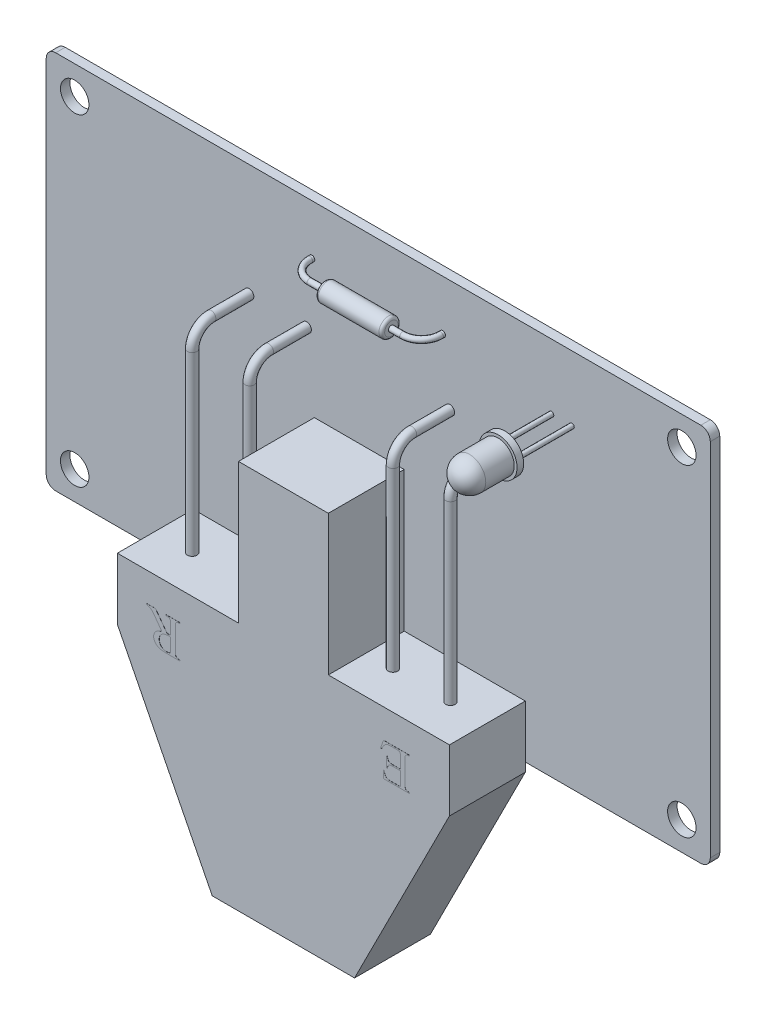
from build123d import *

# Parameters (mm, degrees)
ESQUISSE1_R             = 1.5
BOSS_EXTRU_1_DEPTH      = 1
BOSS_EXTRU_2_START      = 2
BOSS_EXTRU_2_DEPTH      = 8
ESQUISSE3_R             = 0.5
BOSS_EXTRU_3_DEPTH      = 3.5
BOSS_EXTRU_3_DEPTH_BACK = 3.5
BOSS_EXTRU_3_START      = 0.1
ESQUISSE4_R             = 1
ESQUISSE6_R             = 0.3
CONG_1_R                = 0.3
ESQUISSE7_R             = 0.3
CONG_2_R                = 0.3
BOSS_EXTRU_4_START      = 6
ESQUISSE8_R             = 2
BOSS_EXTRU_4_DEPTH      = 0.7
ESQUISSE9_R             = 1.7
BOSS_EXTRU_5_DEPTH      = 3
ESQUISSE10_R            = 0.25
BOSS_EXTRU_6_DEPTH      = 6
BOSS_EXTRU_7_DEPTH      = 0.01


# Read off the part's stored shape, not the designer's step: Dôme1
with BuildPart() as part:
    # Esquisse1 → Boss.-Extru.1 (new body)
    with BuildSketch(Plane.XY):
        with BuildLine():
            Line((-34, 20), (34, 20))
            ThreePointArc((34, 20), (34.707106781, 19.707106781), (35, 19))
            Line((35, 19), (35, -19))
            ThreePointArc((35, -19), (34.707106781, -19.707106781), (34, -20))
            Line((34, -20), (-34, -20))
            ThreePointArc((-34, -20), (-34.707106781, -19.707106781), (-35, -19))
            Line((-35, -19), (-35, 19))
            ThreePointArc((-35, 19), (-34.707106781, 19.707106781), (-34, 20))
        make_face()
        with Locations((-32, 17)):
            Circle(ESQUISSE1_R, mode=Mode.SUBTRACT)
        with Locations((-32, -17)):
            Circle(ESQUISSE1_R, mode=Mode.SUBTRACT)
        with Locations((32, -17)):
            Circle(ESQUISSE1_R, mode=Mode.SUBTRACT)
        with Locations((32, 17)):
            Circle(ESQUISSE1_R, mode=Mode.SUBTRACT)
    extrude(amount=BOSS_EXTRU_1_DEPTH)



with BuildPart() as body_2:
    # Esquisse2 → Boss.-Extru.2 (new body)
    with BuildSketch(Plane.XY.offset(1).offset(BOSS_EXTRU_2_START)):
        Polygon((-7.5, -38.715067479), (7.5, -38.715067479), (17.5, -18.929232373), (17.5, -12.431567499), (4.734720918, -12.431567499), (4.734720918, 2.327559899), (-4.734720918, 2.327559899), (-4.734720918, -12.431567499), (-17.5, -12.431567499), (-17.5, -18.929232373), align=None)
    extrude(amount=BOSS_EXTRU_2_DEPTH)


with BuildPart() as part_1:
    add(part.part)

    add(body_2.part)  # Balayage1 merges body 2
    # Balayage1: sweep along a curve in space
    with BuildLine() as balayage1_path:
        Line((-13.614984304, -12.431567499, 7), (-13.614984304, 6.168998197, 7))
        ThreePointArc((-13.614984304, 6.168998197, 7), (-13.614984304, 7.58321176, 6.414213562), (-13.614984304, 8.168998197, 5))
        Line((-13.614984304, 8.168998197, 5), (-13.614984304, 8.168998197, 0.395838291))
    # Esquisse3 → Balayage1 (sweep)
    with BuildSketch(Plane(origin=(0, -12.431567499, 0), x_dir=(1, 0, 0), z_dir=(0, 1, 0))):
        with Locations((-13.614984304, -7)):
            Circle(ESQUISSE3_R)
        with Locations((-7.547533543, -7)):
            Circle(ESQUISSE3_R)
    balayage1 = sweep(path=balayage1_path.line)

    # Symétrie1: Balayage1 across plane
    add(balayage1.mirror(Plane(origin=(0, 0, 0), x_dir=(0, 0, 1), z_dir=(1, 0, 0))))



with BuildPart() as body_2_2:
    # Esquisse4 → Boss.-Extru.3 (new, two sides: drawn at the far end of the back side and taken through both)
    with BuildSketch(Plane(origin=(0, 0, 0), x_dir=(0, 0, -1), z_dir=(1, 0, 0)).offset(BOSS_EXTRU_3_START - BOSS_EXTRU_3_DEPTH_BACK)):
        with Locations((-3.223593846, 14.735520351)):
            Circle(ESQUISSE4_R)
    extrude(amount=BOSS_EXTRU_3_DEPTH + BOSS_EXTRU_3_DEPTH_BACK)


with BuildPart() as part_2:
    add(part_1.part)

    add(body_2_2.part)  # Balayage2 merges body 2 2
    # Balayage2: sweep along a curve in space
    with BuildLine() as balayage2_path:
        Line((3.6, 14.735520351, 3.223593846), (4.788840172, 14.735520351, 3.223593846))
        ThreePointArc((4.788840172, 14.735520351, 3.223593846), (6.203053735, 14.735520351, 2.637807408), (6.788840172, 14.735520351, 1.223593846))
        Line((6.788840172, 14.735520351, 1.223593846), (6.788840172, 14.735520351, 0.585823354))
    # Esquisse6 → Balayage2 (sweep)
    with BuildSketch(Plane(origin=(3.6, 0, 0), x_dir=(0, 0, -1), z_dir=(1, 0, 0))):
        with Locations((-3.223593846, 14.735520351)):
            Circle(ESQUISSE6_R)
    sweep(path=balayage2_path.line)

    # Congé1
    cong_1_edges = [part_2.edges().sort_by_distance(p)[0] for p in [
        (3.6, 14.735520351, 4.223593846),
    ]]
    fillet(cong_1_edges, radius=CONG_1_R)

    # Balayage3: sweep along a curve in space
    with BuildLine() as balayage3_path:
        Line((-3.4, 14.735520351, 3.223593846), (-4.993022094, 14.735520351, 3.223593846))
        ThreePointArc((-4.993022094, 14.735520351, 3.223593846), (-6.407235656, 14.735520351, 2.637807408), (-6.993022094, 14.735520351, 1.223593846))
        Line((-6.993022094, 14.735520351, 1.223593846), (-6.993022094, 14.735520351, 0.556615196))
    # Esquisse7 → Balayage3 (sweep)
    with BuildSketch(Plane.ZY.offset(3.4)):
        with Locations((3.223593846, 14.735520351)):
            Circle(ESQUISSE7_R)
    sweep(path=balayage3_path.line)

    # Congé2
    cong_2_edges = [part_2.edges().sort_by_distance(p)[0] for p in [
        (-3.4, 14.735520351, 4.223593846),
    ]]
    fillet(cong_2_edges, radius=CONG_2_R)



with BuildPart() as body_2_3:
    # Esquisse8 → Boss.-Extru.4 (new body)
    with BuildSketch(Plane.XY.offset(1).offset(BOSS_EXTRU_4_START)):
        with Locations((19.333488089, 13.149891711)):
            Circle(ESQUISSE8_R)
    extrude(amount=BOSS_EXTRU_4_DEPTH)

    # Esquisse9 → Boss.-Extru.5 (add)
    with BuildSketch(Plane.XY.offset(7.7)):
        with Locations((19.333488089, 13.149891711)):
            Circle(ESQUISSE9_R)
    extrude(amount=BOSS_EXTRU_5_DEPTH)

    # Dôme1 outline → Dôme1 (revolve)
    with BuildSketch(Plane(origin=(19.333488089, 13.149891711, 0), x_dir=(1, 0, 0), z_dir=(0, -1, 0))):
        with BuildLine():
            Line((0, 10.7), (1.7, 10.699999998))
            ThreePointArc((1.7, 10.699999998), (1.202081529, 11.902081527), (0, 12.4))
            Line((0, 12.4), (0, 10.7))
        make_face()
    revolve(axis=Axis((19.333488089, 13.149891711, 0), (0, 0, 1)))


with BuildPart() as part_3:
    add(part_2.part)

    add(body_2_3.part)  # Boss.-Extru.6 merges body 2 3
    # Esquisse10 → Boss.-Extru.6 (add)
    with BuildSketch(Plane(origin=(0, 0, 7), x_dir=(-1, 0, 0), z_dir=(0, 0, -1))):
        with Locations(Location((-18.254291032, 13.149891711, 0), (0, 0, 180))):
            Circle(ESQUISSE10_R)
        with Locations(Location((-20.412685146, 13.149891711, 0), (0, 0, 180))):
            Circle(ESQUISSE10_R)
    extrude(amount=BOSS_EXTRU_6_DEPTH)

    # Esquisse11 → Boss.-Extru.7 (add)
    # profile 1 of 2: a face of its own
    with BuildSketch(Plane.XY.offset(11)):
        with BuildLine():
            Line((12.338483301, -18.829053346), (12.338483301, -17.370720013))
            Line((12.338483301, -17.370720013), (11.512094412, -17.370720013))
            add(Edge.make_bspline(
                [(11.512094412, -17.370720013), (11.48879895, -17.371067889), (11.444201106, -17.371733878), (11.380270892, -17.375188846), (11.322765146, -17.382177375), (11.270756568, -17.390771859), (11.22524989, -17.403890991), (11.185009282, -17.417955311), (11.150824569, -17.435106243), (11.132105402, -17.450154148), (11.123205523, -17.457308554)],
                knots=[0, 0, 0, 0, 1.378335987, 2.638746358, 3.785056891, 4.804577058, 5.753076013, 6.582315378, 7.325973169, 8, 8, 8, 8], degree=3))
            add(Edge.make_bspline(
                [(11.123205523, -17.457308554), (11.112427734, -17.467340676), (11.090607719, -17.487651062), (11.064493143, -17.525576703), (11.039545096, -17.566880415), (11.020493524, -17.614849838), (11.003042768, -17.667378715), (10.9922113, -17.725997109), (10.981209748, -17.789387665), (10.978686202, -17.833737911), (10.97737219, -17.856831124)],
                knots=[0, 0, 0, 0, 0.807279986, 1.634366921, 2.520296536, 3.456336839, 4.464656133, 5.55960839, 6.72928595, 8, 8, 8, 8], degree=3))
            Line((10.97737219, -17.856831124), (10.880149967, -17.856831124))
            Line((10.880149967, -17.856831124), (10.880149967, -16.738775568))
            Line((10.880149967, -16.738775568), (10.97737219, -16.738775568))
            add(Edge.make_bspline(
                [(10.97737219, -16.738775568), (10.982894611, -16.775037747), (10.992851242, -16.840416516), (11.010195872, -16.927642207), (11.026879226, -16.993874727), (11.041878978, -17.029536969), (11.04801021, -17.04411411)],
                knots=[0, 0, 0, 0, 1.400148748, 2.524393252, 3.396837493, 4, 4, 4, 4], degree=3))
            add(Edge.make_bspline(
                [(11.04801021, -17.04411411), (11.056067391, -17.05794322), (11.072269666, -17.085752336), (11.107268267, -17.120663987), (11.147786159, -17.152312384), (11.196999535, -17.17948058), (11.257026743, -17.201149406), (11.330346162, -17.214333082), (11.416661994, -17.223534325), (11.478896247, -17.224416235), (11.512094412, -17.224886679)],
                knots=[0, 0, 0, 0, 0.729849141, 1.467662006, 2.24432869, 3.079667151, 4.029330832, 5.152258494, 6.480904199, 8, 8, 8, 8], degree=3))
            Line((11.512094412, -17.224886679), (12.338483301, -17.224886679))
            Line((12.338483301, -17.224886679), (12.338483301, -16.027838068))
            add(Edge.make_bspline(
                [(12.338483301, -16.027838068), (12.338641918, -16.008846932), (12.33894441, -15.972629719), (12.336916872, -15.921248664), (12.335752061, -15.875651498), (12.333498728, -15.836137183), (12.330537673, -15.802429366), (12.326878687, -15.774533546), (12.322687992, -15.752319354), (12.312655653, -15.722244023), (12.288704755, -15.684479106), (12.248157844, -15.65379776), (12.204664268, -15.635763733), (12.158858625, -15.626874352), (12.101104538, -15.622134706), (12.058728426, -15.621221975), (12.035423405, -15.620720013)],
                knots=[0, 0, 0, 0, 1.289843542, 2.459807399, 3.492255337, 4.388033904, 5.147862575, 5.789969209, 6.299271426, 6.679963479, 7.939644637, 9.263995677, 10.065684139, 11.121501597, 12.416950943, 14, 14, 14, 14], degree=3))
            Line((12.035423405, -15.620720013), (11.412593544, -15.620720013))
            add(Edge.make_bspline(
                [(11.412593544, -15.620720013), (11.364235323, -15.621419843), (11.274539518, -15.622717903), (11.150338709, -15.62898734), (11.04761427, -15.64352175), (10.96196129, -15.661820642), (10.888654584, -15.690959583), (10.819908709, -15.729121379), (10.752254145, -15.777464587), (10.710816827, -15.816904952), (10.689503266, -15.837191367)],
                knots=[0, 0, 0, 0, 1.488624476, 2.761130766, 3.82343653, 4.6796502, 5.449456535, 6.241116165, 7.0953064, 8, 8, 8, 8], degree=3))
            add(Edge.make_bspline(
                [(10.689503266, -15.837191367), (10.660764519, -15.868569052), (10.599196981, -15.935790033), (10.514722704, -16.054823658), (10.42786354, -16.194011766), (10.373881228, -16.296085), (10.345427745, -16.349886679)],
                knots=[0, 0, 0, 0, 0.823493647, 1.764185327, 2.821526682, 4, 4, 4, 4], degree=3))
            Line((10.345427745, -16.349886679), (10.248205523, -16.349886679))
            Line((10.248205523, -16.349886679), (10.563418197, -15.474886679))
            Line((10.563418197, -15.474886679), (13.310705523, -15.474886679))
            Line((13.310705523, -15.474886679), (13.310705523, -15.572108901))
            Line((13.310705523, -15.572108901), (13.190696842, -15.572108901))
            add(Edge.make_bspline(
                [(13.190696842, -15.572108901), (13.170893275, -15.57284266), (13.131213336, -15.574312876), (13.072741095, -15.586122438), (13.015662786, -15.605012294), (12.980082092, -15.623510043), (12.96207271, -15.63287279)],
                knots=[0, 0, 0, 0, 0.993225946, 1.990103322, 2.982678719, 4, 4, 4, 4], degree=3))
            add(Edge.make_bspline(
                [(12.96207271, -15.63287279), (12.949536834, -15.640210194), (12.924744639, -15.654721373), (12.894530057, -15.68525355), (12.869122388, -15.719927806), (12.851016304, -15.763533147), (12.837894869, -15.820314929), (12.831364872, -15.896330827), (12.824591286, -15.994046378), (12.824593303, -16.066807561), (12.824594412, -16.106831124)],
                knots=[0, 0, 0, 0, 0.667424382, 1.319964713, 1.964934227, 2.639778616, 3.481178233, 4.644661352, 6.154337226, 8, 8, 8, 8], degree=3))
            Line((12.824594412, -16.106831124), (12.824594412, -18.342942235))
            add(Edge.make_bspline(
                [(12.824594412, -18.342942235), (12.824657139, -18.370542761), (12.824775733, -18.422725064), (12.827851848, -18.496952553), (12.83280386, -18.562626154), (12.840516263, -18.620129782), (12.849448292, -18.66935856), (12.859438269, -18.710869979), (12.872684445, -18.744072197), (12.884589622, -18.761853711), (12.889915592, -18.769808554)],
                knots=[0, 0, 0, 0, 1.515881669, 2.865966962, 4.079749853, 5.131974021, 6.051177267, 6.826960379, 7.475222119, 8, 8, 8, 8], degree=3))
            add(Edge.make_bspline(
                [(12.889915592, -18.769808554), (12.906551153, -18.786651625), (12.941152339, -18.821684423), (13.012788292, -18.853480666), (13.096759168, -18.87476443), (13.157861639, -18.876650774), (13.190696842, -18.877664457)],
                knots=[0, 0, 0, 0, 0.855787197, 1.779997221, 2.807016444, 4, 4, 4, 4], degree=3))
            Line((13.190696842, -18.877664457), (13.310705523, -18.877664457))
            Line((13.310705523, -18.877664457), (13.310705523, -18.974886679))
            Line((13.310705523, -18.974886679), (10.588483301, -18.974886679))
            Line((10.588483301, -18.974886679), (10.53987219, -18.197108901))
            Line((10.53987219, -18.197108901), (10.637094412, -18.197108901))
            add(Edge.make_bspline(
                [(10.637094412, -18.197108901), (10.646230085, -18.243798005), (10.663055316, -18.329785643), (10.692874251, -18.446159392), (10.724212011, -18.539182167), (10.757830395, -18.61186497), (10.798227491, -18.668865907), (10.846270287, -18.714721304), (10.90041314, -18.756670263), (10.942231217, -18.776393075), (10.963700315, -18.786518624)],
                knots=[0, 0, 0, 0, 1.615738306, 2.975716147, 4.077183897, 4.94643523, 5.686210022, 6.434186835, 7.196122841, 8, 8, 8, 8], degree=3))
            add(Edge.make_bspline(
                [(10.963700315, -18.786518624), (10.984847146, -18.793094089), (11.033213815, -18.808133382), (11.118273965, -18.820330909), (11.223335703, -18.827274741), (11.300163116, -18.828426704), (11.341955523, -18.829053346)],
                knots=[0, 0, 0, 0, 0.694416245, 1.588256909, 2.688065314, 4, 4, 4, 4], degree=3))
            Line((11.341955523, -18.829053346), (12.338483301, -18.829053346))
        make_face()
    # profile 2 of 2: a face of its own
    with BuildSketch(Plane.XY.offset(11)):
        with BuildLine():
            Line((-14.428769303, -15.474886679), (-13.470218956, -15.474886679))
            Line((-13.470218956, -15.474886679), (-12.254941178, -17.127664457))
            add(Edge.make_bspline(
                [(-12.254941178, -17.127664457), (-12.232916251, -17.126831454), (-12.19115008, -17.125251819), (-12.131635547, -17.124130665), (-12.078738518, -17.121985702), (-12.045560655, -17.12223265), (-12.03011479, -17.122347617)],
                knots=[0, 0, 0, 0, 1.175953677, 2.229977037, 3.17597052, 4, 4, 4, 4], degree=3))
            add(Edge.make_bspline(
                [(-12.03011479, -17.122347617), (-12.017706082, -17.122214273), (-11.992372262, -17.121942038), (-11.953154341, -17.124104752), (-11.912111016, -17.125162529), (-11.884024984, -17.126825274), (-11.869850033, -17.127664457)],
                knots=[0, 0, 0, 0, 0.928224334, 1.895077967, 2.937651046, 4, 4, 4, 4], degree=3))
            Line((-11.869850033, -17.127664457), (-11.869850033, -16.106831124))
            add(Edge.make_bspline(
                [(-11.869850033, -16.106831124), (-11.869816173, -16.079985467), (-11.869751926, -16.029047796), (-11.8740753, -15.956638262), (-11.878858615, -15.892211401), (-11.886351657, -15.835908887), (-11.895860426, -15.787514341), (-11.90830067, -15.747355933), (-11.920668419, -15.713551568), (-11.933772989, -15.696203747), (-11.939728505, -15.688319839)],
                knots=[0, 0, 0, 0, 1.497678783, 2.841736059, 4.046716882, 5.101722736, 6.01056545, 6.792749087, 7.451351549, 8, 8, 8, 8], degree=3))
            add(Edge.make_bspline(
                [(-11.939728505, -15.688319839), (-11.956609155, -15.670326252), (-11.990647753, -15.634043496), (-12.058728373, -15.597607522), (-12.137670508, -15.576136904), (-12.194023498, -15.573501444), (-12.223799685, -15.572108901)],
                knots=[0, 0, 0, 0, 0.928083312, 1.87141226, 2.875281911, 4, 4, 4, 4], degree=3))
            Line((-12.223799685, -15.572108901), (-12.355961144, -15.572108901))
            Line((-12.355961144, -15.572108901), (-12.355961144, -15.474886679))
            Line((-12.355961144, -15.474886679), (-10.89762781, -15.474886679))
            Line((-10.89762781, -15.474886679), (-10.89762781, -15.572108901))
            Line((-10.89762781, -15.572108901), (-11.024472428, -15.572108901))
            add(Edge.make_bspline(
                [(-11.024472428, -15.572108901), (-11.041712219, -15.572515989), (-11.075070649, -15.573303689), (-11.123220975, -15.580209422), (-11.167571963, -15.591561405), (-11.208496277, -15.607311486), (-11.244863539, -15.629036298), (-11.278367862, -15.654159093), (-11.307191473, -15.68477933), (-11.323253438, -15.707856942), (-11.331330067, -15.719461332)],
                knots=[0, 0, 0, 0, 1.160123857, 2.244801576, 3.265881969, 4.23754323, 5.184678159, 6.10852314, 7.048886137, 8, 8, 8, 8], degree=3))
            add(Edge.make_bspline(
                [(-11.331330067, -15.719461332), (-11.335594915, -15.727467315), (-11.344911627, -15.744956673), (-11.355280334, -15.776227951), (-11.364041025, -15.814130845), (-11.371833914, -15.859243378), (-11.376295256, -15.911341501), (-11.381476148, -15.970275077), (-11.383249966, -16.036183749), (-11.383570707, -16.082526443), (-11.383738921, -16.106831124)],
                knots=[0, 0, 0, 0, 0.551411268, 1.204577642, 1.997081486, 2.919382768, 3.988297814, 5.178651103, 6.520328034, 8, 8, 8, 8], degree=3))
            Line((-11.383738921, -16.106831124), (-11.383738921, -18.342942235))
            add(Edge.make_bspline(
                [(-11.383738921, -18.342942235), (-11.383772782, -18.369787891), (-11.383837029, -18.420725562), (-11.379513654, -18.493135097), (-11.374730339, -18.557561957), (-11.367237297, -18.613864471), (-11.357728528, -18.662259017), (-11.345288284, -18.702417425), (-11.332920535, -18.736221791), (-11.319815965, -18.753569612), (-11.313860449, -18.761453519)],
                knots=[0, 0, 0, 0, 1.497678783, 2.841736059, 4.046716882, 5.101722736, 6.01056545, 6.792749087, 7.451351549, 8, 8, 8, 8], degree=3))
            add(Edge.make_bspline(
                [(-11.313860449, -18.761453519), (-11.296442057, -18.77942505), (-11.261426123, -18.81555295), (-11.192370262, -18.852361449), (-11.112074472, -18.873585888), (-11.05474467, -18.876255044), (-11.024472428, -18.877664457)],
                knots=[0, 0, 0, 0, 0.928124107, 1.865794122, 2.873060895, 4, 4, 4, 4], degree=3))
            Line((-11.024472428, -18.877664457), (-10.89762781, -18.877664457))
            Line((-10.89762781, -18.877664457), (-10.89762781, -18.974886679))
            Line((-10.89762781, -18.974886679), (-12.191139095, -18.974886679))
            add(Edge.make_bspline(
                [(-12.191139095, -18.974886679), (-12.236713092, -18.974472879), (-12.324832249, -18.973672779), (-12.452480771, -18.971009488), (-12.570798535, -18.965222276), (-12.679866782, -18.955558078), (-12.7798179, -18.945741969), (-12.870254895, -18.931975213), (-12.951373266, -18.916065573), (-13.046518411, -18.892475811), (-13.15551241, -18.853011066), (-13.275549729, -18.78821141), (-13.385459767, -18.707164118), (-13.467747159, -18.626972957), (-13.526175243, -18.555990079), (-13.564301513, -18.499531877), (-13.596682099, -18.440667805), (-13.622091614, -18.379052961), (-13.643066017, -18.315161248), (-13.658295647, -18.248863997), (-13.666559157, -18.179595837), (-13.667819383, -18.132821011), (-13.668461144, -18.109001263)],
                knots=[0, 0, 0, 0, 1.414956102, 2.735874536, 3.963705462, 5.091690825, 6.135080673, 7.081106307, 7.930500515, 8.700697633, 10.123057601, 11.515743401, 12.92123598, 14.349772565, 15.070402856, 15.772401426, 16.461833559, 17.152340272, 17.838403494, 18.547756702, 19.260455422, 20, 20, 20, 20], degree=3))
            add(Edge.make_bspline(
                [(-13.668461144, -18.109001263), (-13.668032579, -18.083387756), (-13.667188482, -18.032939716), (-13.655877307, -17.958999072), (-13.63896845, -17.887682036), (-13.616752208, -17.818296082), (-13.58578685, -17.752269759), (-13.549172598, -17.688563731), (-13.50549813, -17.627672191), (-13.455535666, -17.56912211), (-13.39811856, -17.51407388), (-13.333145281, -17.463123978), (-13.2609457, -17.416163845), (-13.181472184, -17.373375796), (-13.094559713, -17.335864418), (-13.000880038, -17.301387774), (-12.899518994, -17.271914783), (-12.828997681, -17.255910343), (-12.792701595, -17.247673138)],
                knots=[0, 0, 0, 0, 0.915495337, 1.803148131, 2.668716084, 3.536555624, 4.403827826, 5.272234335, 6.161917951, 7.080454809, 8.022099795, 9.002372815, 10.02983735, 11.09966218, 12.22713023, 13.413382736, 14.668713356, 16, 16, 16, 16], degree=3))
            Line((-12.792701595, -17.247673138), (-13.54465472, -16.192660117))
            add(Edge.make_bspline(
                [(-13.54465472, -16.192660117), (-13.564799017, -16.16422391), (-13.603560135, -16.109507721), (-13.661491153, -16.031520013), (-13.71713182, -15.961048192), (-13.771570143, -15.898631931), (-13.822793797, -15.842673026), (-13.872954812, -15.795236404), (-13.919994239, -15.754079378), (-13.981687063, -15.710202328), (-14.063900971, -15.664234942), (-14.17346879, -15.622274617), (-14.296226914, -15.58991148), (-14.383269545, -15.578220252), (-14.428769303, -15.572108901)],
                knots=[0, 0, 0, 0, 1.114486745, 2.144465635, 3.106816173, 3.985100294, 4.79292302, 5.531730334, 6.192192322, 6.789911883, 7.949972406, 9.19350452, 10.532961766, 12, 12, 12, 12], degree=3))
            Line((-14.428769303, -15.572108901), (-14.428769303, -15.474886679))
        make_face()
        with BuildLine():
            add(Edge.make_bspline(
                [(-11.869850033, -17.27349779), (-11.885799847, -17.273529433), (-11.915676404, -17.273588705), (-11.956967207, -17.273210387), (-11.991611201, -17.270857582), (-12.012389333, -17.271106768), (-12.021759755, -17.271219144)],
                knots=[0, 0, 0, 0, 1.25966296, 2.359550474, 3.260197944, 4, 4, 4, 4], degree=3))
            add(Edge.make_bspline(
                [(-12.021759755, -17.271219144), (-12.06431191, -17.272047539), (-12.147000812, -17.273657304), (-12.267071709, -17.283214801), (-12.379160429, -17.300302724), (-12.482802378, -17.325846366), (-12.579076947, -17.356245334), (-12.666821667, -17.395204694), (-12.746512883, -17.441025041), (-12.817951595, -17.49316921), (-12.88051596, -17.551603332), (-12.935358633, -17.613442448), (-12.981212702, -17.679726495), (-13.020110922, -17.748984097), (-13.048257207, -17.823223258), (-13.070382649, -17.900558765), (-13.082127033, -17.982053769), (-13.084118556, -18.037571812), (-13.08512781, -18.065706992)],
                knots=[0, 0, 0, 0, 1.366264329, 2.654974796, 3.864465074, 5.002079205, 6.079184957, 7.101815526, 8.07782847, 9.02571148, 9.934553078, 10.821612276, 11.674026241, 12.518065627, 13.364918747, 14.216906243, 15.096371929, 16, 16, 16, 16], degree=3))
            add(Edge.make_bspline(
                [(-13.08512781, -18.065706992), (-13.0847116, -18.093345825), (-13.083894958, -18.147575622), (-13.072572302, -18.226545306), (-13.056246852, -18.301698707), (-13.032330073, -18.372881242), (-13.002242089, -18.440556995), (-12.964701307, -18.503769615), (-12.920783883, -18.563155439), (-12.87048528, -18.618026972), (-12.814009561, -18.667408868), (-12.753159874, -18.711045493), (-12.687575736, -18.747505055), (-12.617743319, -18.777224727), (-12.54382152, -18.800979906), (-12.465179033, -18.817478348), (-12.382304256, -18.827556461), (-12.325608496, -18.828548038), (-12.296716352, -18.829053346)],
                knots=[0, 0, 0, 0, 1.072933193, 2.105188328, 3.093187288, 4.057495009, 5.017327028, 5.965443752, 6.907827911, 7.882515564, 8.851378189, 9.817640641, 10.786453328, 11.760346452, 12.762059495, 13.798104109, 14.877914429, 16, 16, 16, 16], degree=3))
            add(Edge.make_bspline(
                [(-12.296716352, -18.829053346), (-12.26803531, -18.82767272), (-12.205386494, -18.824656981), (-12.10533671, -18.804776193), (-11.991495345, -18.774101138), (-11.91221769, -18.746553281), (-11.869850033, -18.731831124)],
                knots=[0, 0, 0, 0, 0.782866884, 1.710038394, 2.776196045, 4, 4, 4, 4], degree=3))
            Line((-11.869850033, -18.731831124), (-11.869850033, -17.27349779))
        make_face(mode=Mode.SUBTRACT)
    extrude(amount=BOSS_EXTRU_7_DEPTH)


solid = part_3.part
